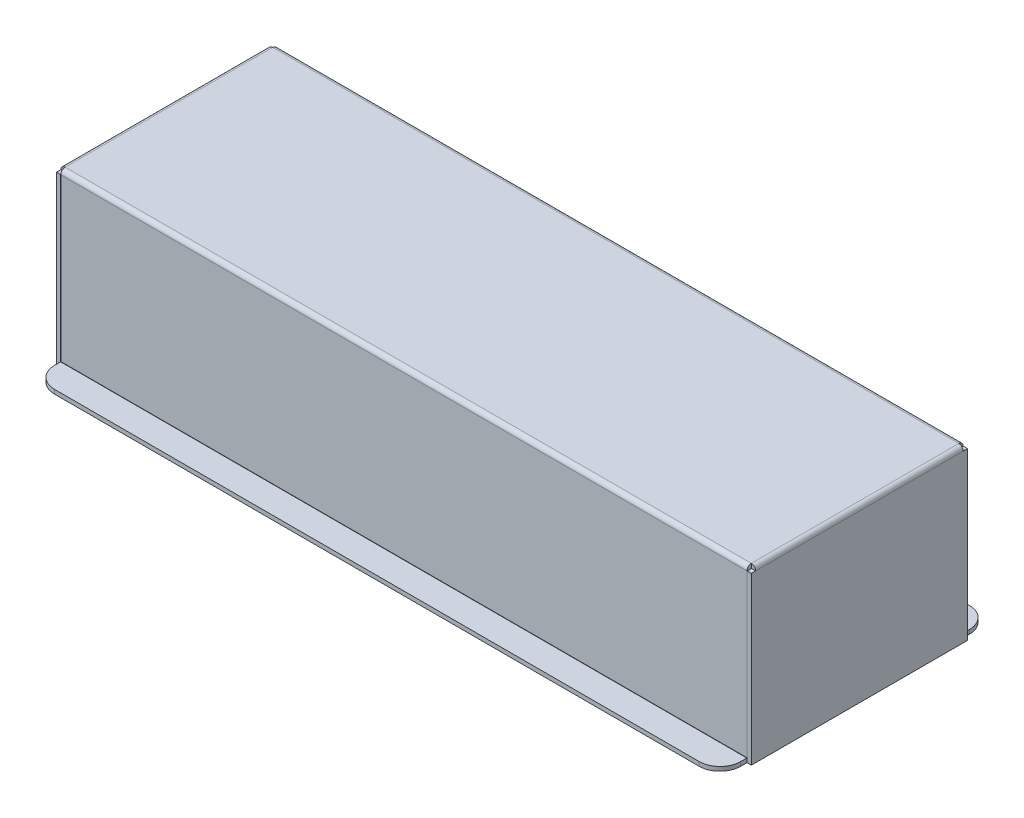
from build123d import *

# Parameters (mm, degrees)
SKIZZE3_W                          = 330
SKIZZE3_H                          = 100
BASIS_BLECH1_DEPTH                 = 2
KANTE_LASCHE1_STRIP_W              = 8.2
KANTE_LASCHE1_STRIP_H              = 2
KANTE_LASCHE1_STRIP_CUT_DEPTH      = 330
KANTE_LASCHE1_STRIP_2_W            = 8.2
KANTE_LASCHE1_STRIP_2_H            = 2
KANTE_LASCHE1_STRIP_CUT_2_DEPTH    = 330
KANTE_LASCHE1_DEPTH                = 330
KANTE_LASCHE1_BEND_DEPTH           = 330
KANTE_LASCHE5_DEPTH                = 99.8
KANTE_LASCHE5_BEND_DEPTH           = 99.8
KANTE_LASCHE3_STRIP_W              = 8.2
KANTE_LASCHE3_STRIP_H              = 2
KANTE_LASCHE3_STRIP_CUT_DEPTH      = 330
KANTE_LASCHE3_STRIP_2_W            = 8.2
KANTE_LASCHE3_STRIP_2_H            = 2
KANTE_LASCHE3_STRIP_CUT_2_DEPTH    = 330
KANTE_LASCHE3_DEPTH                = 330
KANTE_LASCHE3_BEND_DEPTH           = 330
VERRUNDUNG2_R                      = 10
F_5_0_5_DURCHMESSER_BOHRUNG1_D     = 5
F_5_0_5_DURCHMESSER_BOHRUNG1_DEPTH = 10
F_5_0_5_DURCHMESSER_BOHRUNG1_TIP   = 1.502151548
GESCHLOSSENE_START                 = -52
GESCHLOSSENE_ECKE2_OUTLINE_W       = 2
GESCHLOSSENE_ECKE2_OUTLINE_H       = 79.9
GESCHLOSSENE_ECKE2_DEPTH           = 2.1
GESCHLOSSENE_START_2               = 49.9
GESCHLOSSENE_ECKE2_2_OUTLINE_W     = 2
GESCHLOSSENE_ECKE2_2_OUTLINE_H     = 79.9
GESCHLOSSENE_ECKE2_2_DEPTH         = 2.1


# Read off the part's stored shape, not the designer's step: Geschlossene Ecke2
# Sheet-metal steps are written as plain solids
with BuildPart() as part:
    # Skizze3 → Basis-Blech1 (new body)
    with BuildSketch(Plane(origin=(0, 0, 0), x_dir=(1, 0, 0), z_dir=(0, 1, 0))):
        Rectangle(SKIZZE3_W, SKIZZE3_H)
    extrude(amount=-BASIS_BLECH1_DEPTH)

    # Kante-Lasche1 strip (across the edge) → Kante-Lasche1 strip cut (cut)
    with BuildSketch(Plane(origin=(-165, -2, -50), x_dir=(0, 0, 1), z_dir=(1, 0, 0))):
        with Locations((-4, -1)):
            Rectangle(KANTE_LASCHE1_STRIP_W, KANTE_LASCHE1_STRIP_H)
    extrude(amount=KANTE_LASCHE1_STRIP_CUT_DEPTH, mode=Mode.SUBTRACT)

    # Kante-Lasche1 strip 2 (across the edge) → Kante-Lasche1 strip cut 2 (cut)
    with BuildSketch(Plane(origin=(165, -2, 50), x_dir=(0, 0, -1), z_dir=(-1, 0, 0))):
        with Locations((-4, -1)):
            Rectangle(KANTE_LASCHE1_STRIP_2_W, KANTE_LASCHE1_STRIP_2_H)
    extrude(amount=KANTE_LASCHE1_STRIP_CUT_2_DEPTH, mode=Mode.SUBTRACT)

    # Kante-Lasche1 section (across the edge) → Kante-Lasche1 (add)
    with BuildSketch(Plane(origin=(-165, -2, -50), x_dir=(0, 0, 1), z_dir=(1, 0, 0))):
        with BuildLine():
            Line((-2, 0.1), (-2, 80))
            Line((-2, 80), (0, 80))
            Line((0, 80), (0, 0.1))
            ThreePointArc((0, 0.1), (0.029289322, 0.029289322), (0.1, 0))
            Line((0.1, 0), (0.1, -2))
            ThreePointArc((0.1, -2), (-1.38492424, -1.38492424), (-2, 0.1))
        make_face()
    extrude(amount=KANTE_LASCHE1_DEPTH)

    # Kante-Lasche1 section 2 (across the edge) → Kante-Lasche1 bend (add)
    with BuildSketch(Plane(origin=(165, -2, 50), x_dir=(0, 0, -1), z_dir=(-1, 0, 0))):
        with BuildLine():
            Line((-2, 0.1), (-2, 80))
            Line((-2, 80), (0, 80))
            Line((0, 80), (0, 0.1))
            ThreePointArc((0, 0.1), (0.029289322, 0.029289322), (0.1, 0))
            Line((0.1, 0), (0.1, -2))
            ThreePointArc((0.1, -2), (-1.38492424, -1.38492424), (-2, 0.1))
        make_face()
    extrude(amount=KANTE_LASCHE1_BEND_DEPTH)

    # Kante-Lasche5 section (across the edge) → Kante-Lasche5 (add)
    with BuildSketch(Plane(origin=(-165.1, -2, 49.9), x_dir=(1, 0, 0), z_dir=(0, 0, -1))):
        with BuildLine():
            Line((-2, 0.1), (-2, 80))
            Line((-2, 80), (0, 80))
            Line((0, 80), (0, 0.1))
            ThreePointArc((0, 0.1), (0.029289322, 0.029289322), (0.1, 0))
            Line((0.1, 0), (0.1, -2))
            ThreePointArc((0.1, -2), (-1.38492424, -1.38492424), (-2, 0.1))
        make_face()
    extrude(amount=KANTE_LASCHE5_DEPTH)

    # Kante-Lasche5 section 2 (across the edge) → Kante-Lasche5 bend (add)
    with BuildSketch(Plane(origin=(165.1, -2, -49.9), x_dir=(-1, 0, 0), z_dir=(0, 0, 1))):
        with BuildLine():
            Line((-2, 0.1), (-2, 80))
            Line((-2, 80), (0, 80))
            Line((0, 80), (0, 0.1))
            ThreePointArc((0, 0.1), (0.029289322, 0.029289322), (0.1, 0))
            Line((0.1, 0), (0.1, -2))
            ThreePointArc((0.1, -2), (-1.38492424, -1.38492424), (-2, 0.1))
        make_face()
    extrude(amount=KANTE_LASCHE5_BEND_DEPTH)

    # Kante-Lasche3 strip (across the edge) → Kante-Lasche3 strip cut (cut)
    with BuildSketch(Plane(origin=(-165, -82, 52), x_dir=(0, 1, 0), z_dir=(1, 0, 0))):
        with Locations((-2, -1)):
            Rectangle(KANTE_LASCHE3_STRIP_W, KANTE_LASCHE3_STRIP_H)
    extrude(amount=KANTE_LASCHE3_STRIP_CUT_DEPTH, mode=Mode.SUBTRACT)

    # Kante-Lasche3 strip 2 (across the edge) → Kante-Lasche3 strip cut 2 (cut)
    with BuildSketch(Plane(origin=(165, -82, -52), x_dir=(0, 1, 0), z_dir=(-1, 0, 0))):
        with Locations((-2, -1)):
            Rectangle(KANTE_LASCHE3_STRIP_2_W, KANTE_LASCHE3_STRIP_2_H)
    extrude(amount=KANTE_LASCHE3_STRIP_CUT_2_DEPTH, mode=Mode.SUBTRACT)

    # Kante-Lasche3 section (across the edge) → Kante-Lasche3 (add)
    with BuildSketch(Plane(origin=(-165, -82, 52), x_dir=(0, 1, 0), z_dir=(1, 0, 0))):
        with BuildLine():
            Line((0, 0.1), (0, 13))
            Line((0, 13), (2, 13))
            Line((2, 13), (2, 0.1))
            ThreePointArc((2, 0.1), (2.029289322, 0.029289322), (2.1, 0))
            Line((2.1, 0), (2.1, -2))
            ThreePointArc((2.1, -2), (0.61507576, -1.38492424), (0, 0.1))
        make_face()
    extrude(amount=KANTE_LASCHE3_DEPTH)

    # Kante-Lasche3 section 2 (across the edge) → Kante-Lasche3 bend (add)
    with BuildSketch(Plane(origin=(165, -82, -52), x_dir=(0, 1, 0), z_dir=(-1, 0, 0))):
        with BuildLine():
            Line((0, 0.1), (0, 13))
            Line((0, 13), (2, 13))
            Line((2, 13), (2, 0.1))
            ThreePointArc((2, 0.1), (2.029289322, 0.029289322), (2.1, 0))
            Line((2.1, 0), (2.1, -2))
            ThreePointArc((2.1, -2), (0.61507576, -1.38492424), (0, 0.1))
        make_face()
    extrude(amount=KANTE_LASCHE3_BEND_DEPTH)

    # Verrundung2
    verrundung2_edges = [part.edges().sort_by_distance(p)[0] for p in [
        (-165, -81, 65),
        (165, -81, 65),
        (165, -81, -65),
        (-165, -81, -65),
    ]]
    fillet(verrundung2_edges, radius=VERRUNDUNG2_R)

    # Ø5.0 (5) Durchmesser Bohrung1
    with Locations(Plane.ZY.offset(167.1)):
        with Locations((32, -41), (-32, -41)):
            Hole(F_5_0_5_DURCHMESSER_BOHRUNG1_D / 2, depth=F_5_0_5_DURCHMESSER_BOHRUNG1_DEPTH)
            with Locations((0, 0, -(F_5_0_5_DURCHMESSER_BOHRUNG1_DEPTH + F_5_0_5_DURCHMESSER_BOHRUNG1_TIP / 2))):  # 118° drill point
                Cone(0, F_5_0_5_DURCHMESSER_BOHRUNG1_D / 2, F_5_0_5_DURCHMESSER_BOHRUNG1_TIP, mode=Mode.SUBTRACT)

    # Geschlossene Ecke2 outline → Geschlossene Ecke2 (add)
    with BuildSketch(Plane.XY.offset(GESCHLOSSENE_START)):
        with Locations((-166.1, -42.05)):
            Rectangle(GESCHLOSSENE_ECKE2_OUTLINE_W, GESCHLOSSENE_ECKE2_OUTLINE_H)
        with Locations((166.1, -42.05)):
            Rectangle(GESCHLOSSENE_ECKE2_OUTLINE_W, GESCHLOSSENE_ECKE2_OUTLINE_H)
    extrude(amount=GESCHLOSSENE_ECKE2_DEPTH)

    # Geschlossene Ecke2 2 outline → Geschlossene Ecke2 2 (add)
    with BuildSketch(Plane.XY.offset(GESCHLOSSENE_START_2)):
        with Locations((-166.1, -42.05)):
            Rectangle(GESCHLOSSENE_ECKE2_2_OUTLINE_W, GESCHLOSSENE_ECKE2_2_OUTLINE_H)
        with Locations((166.1, -42.05)):
            Rectangle(GESCHLOSSENE_ECKE2_2_OUTLINE_W, GESCHLOSSENE_ECKE2_2_OUTLINE_H)
    extrude(amount=GESCHLOSSENE_ECKE2_2_DEPTH)


solid = part.part
